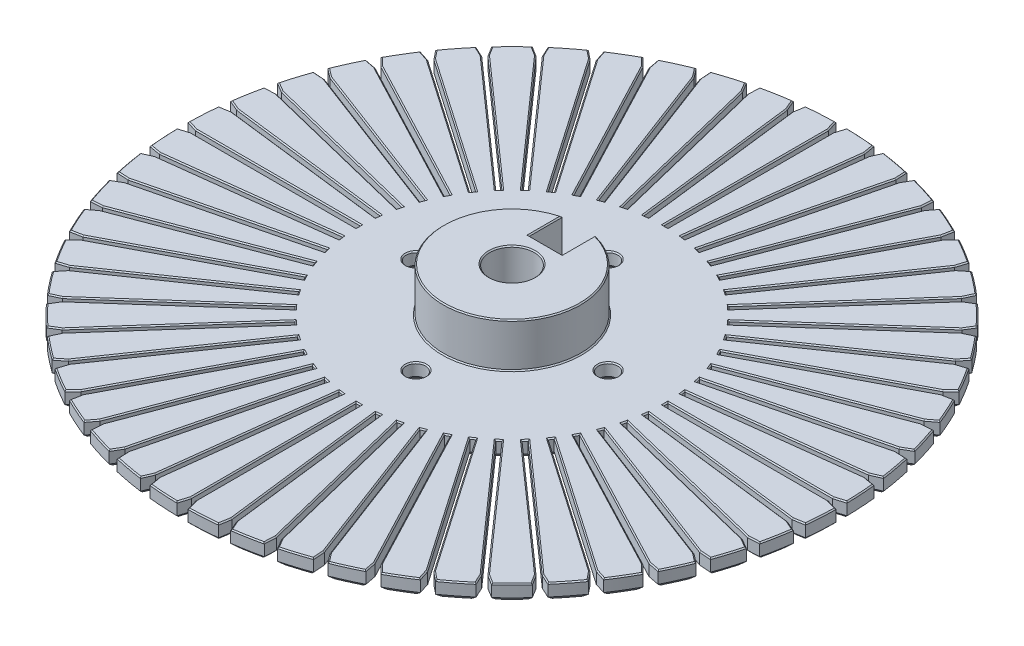
from build123d import *

# Parameters (mm, degrees)
SKIZZE1_R                       = 60
AUFSATZ_LINEAR_AUSTRAGEN1_DEPTH = 3
SCHNITT_LINEAR_START            = -5
SCHNITT_LINEAR_AUSTRAGEN1_DEPTH = 5
AUFSATZ_LINEAR_AUSTRAGEN2_DEPTH = 8
SKIZZE4_R                       = 4.05
SCHNITT_LINEAR_AUSTRAGEN4_DEPTH = 86.551154288
SKIZZE5_R                       = 1.75
SCHNITT_LINEAR_AUSTRAGEN5_DEPTH = 3
FASE1_SIZE                      = 0.8
FASE2_SIZE                      = 0.2


with BuildPart() as part:
    # Skizze1 → Aufsatz-Linear austragen1 (new body)
    with BuildSketch(Plane(origin=(0, 0, 0), x_dir=(1, 0, 0), z_dir=(0, 1, 0))):
        with Locations(Location((0, 0, 0), (0, 0, 270))):
            Circle(SKIZZE1_R)
    extrude(amount=AUFSATZ_LINEAR_AUSTRAGEN1_DEPTH)

    # Skizze2 → Schnitt-Linear austragen1 (cut)
    with BuildSketch(Plane(origin=(0, 3, 0), x_dir=(1, 0, 0), z_dir=(0, 1, 0)).offset(SCHNITT_LINEAR_START)):
        with BuildLine():
            Line((27.991666088, 0.4), (27.991666088, -0.4))
            Line((27.991666088, -0.4), (57.991666088, -0.4))
            Line((57.991666088, -0.4), (59.991666088, -1))
            ThreePointArc((59.991666088, -1), (60, 0), (59.991666088, 1))
            Line((59.991666088, 1), (57.991666088, 0.4))
            Line((57.991666088, 0.4), (27.991666088, 0.4))
        make_face()
        with BuildLine():
            Line((27.835789998, -2.976938955), (27.739360654, -3.771106055))
            Line((27.739360654, -3.771106055), (57.520626877, -7.387206462))
            Line((57.520626877, -7.387206462), (59.433722617, -8.223905147))
            ThreePointArc((59.433722617, -8.223905147), (59.562532446, -7.232200815), (59.674795978, -6.238487399))
            Line((59.674795978, -6.238487399), (57.617056221, -6.593039363))
            Line((57.617056221, -6.593039363), (27.835789998, -2.976938955))
        make_face()
        with BuildLine():
            Line((27.27400541, -6.310467437), (27.082552878, -7.087220891))
            Line((27.082552878, -7.087220891), (56.210807401, -14.26669082))
            Line((56.210807401, -14.26669082), (58.009101637, -15.327887239))
            ThreePointArc((58.009101637, -15.327887239), (58.256509046, -14.358939857), (58.487732966, -13.386003604))
            Line((58.487732966, -13.386003604), (56.402259933, -13.489937366))
            Line((56.402259933, -13.489937366), (27.27400541, -6.310467437))
        make_face()
        with BuildLine():
            Line((26.314504407, -9.551975094), (26.030820497, -10.299988088))
            Line((26.030820497, -10.299988088), (54.081307778, -20.9381347))
            Line((54.081307778, -20.9381347), (55.738577331, -22.208354219))
            ThreePointArc((55.738577331, -22.208354219), (56.100974561, -21.276293223), (56.447787105, -20.338321734))
            Line((56.447787105, -20.338321734), (54.364991687, -20.190121705))
            Line((54.364991687, -20.190121705), (26.314504407, -9.551975094))
        make_face()
        with BuildLine():
            Line((24.971278674, -12.654193445), (24.599500137, -13.362558265))
            Line((24.599500137, -13.362558265), (51.163180906, -27.304253427))
            Line((51.163180906, -27.304253427), (52.655259054, -28.764973386))
            ThreePointArc((52.655259054, -28.764973386), (53.127361539, -27.883390323), (53.584705399, -26.994061335))
            Line((53.584705399, -26.994061335), (51.534959444, -26.595888606))
            Line((51.534959444, -26.595888606), (24.971278674, -12.654193445))
        make_face()
        with BuildLine():
            Line((23.263915469, -15.57188516), (22.809463671, -16.230272253))
            Line((22.809463671, -16.230272253), (47.498979648, -33.272214655))
            Line((47.498979648, -33.272214655), (48.804108532, -34.902134468))
            ThreePointArc((48.804108532, -34.902134468), (49.379031954, -34.083884804), (49.940238025, -33.256166736))
            Line((49.940238025, -33.256166736), (47.953431445, -32.613827562))
            Line((47.953431445, -32.613827562), (23.263915469, -15.57188516))
        make_face()
        with BuildLine():
            Line((21.217311989, -18.262503726), (20.686813863, -18.861312324))
            Line((20.686813863, -18.861312324), (43.142136308, -38.754992071))
            Line((43.142136308, -38.754992071), (44.241284209, -40.530343837))
            ThreePointArc((44.241284209, -40.530343837), (44.91064489, -39.787359494), (45.567529526, -39.03332234))
            Line((45.567529526, -39.03332234), (43.672634434, -38.156183473))
            Line((43.672634434, -38.156183473), (21.217311989, -18.262503726))
        make_face()
        with BuildLine():
            Line((18.861312324, -20.686813863), (18.262503726, -21.217311989))
            Line((18.262503726, -21.217311989), (38.156183473, -43.672634434))
            Line((38.156183473, -43.672634434), (39.03332234, -45.567529526))
            ThreePointArc((39.03332234, -45.567529526), (39.787359494, -44.91064489), (40.530343837, -44.241284209))
            Line((40.530343837, -44.241284209), (38.754992071, -43.142136308))
            Line((38.754992071, -43.142136308), (18.861312324, -20.686813863))
        make_face()
        with BuildLine():
            Line((16.230272253, -22.809463671), (15.57188516, -23.263915469))
            Line((15.57188516, -23.263915469), (32.613827562, -47.953431445))
            Line((32.613827562, -47.953431445), (33.256166736, -49.940238025))
            ThreePointArc((33.256166736, -49.940238025), (34.083884804, -49.379031954), (34.902134468, -48.804108532))
            Line((34.902134468, -48.804108532), (33.272214655, -47.498979648))
            Line((33.272214655, -47.498979648), (16.230272253, -22.809463671))
        make_face()
        with BuildLine():
            Line((13.362558265, -24.599500137), (12.654193445, -24.971278674))
            Line((12.654193445, -24.971278674), (26.595888606, -51.534959444))
            Line((26.595888606, -51.534959444), (26.994061335, -53.584705399))
            ThreePointArc((26.994061335, -53.584705399), (27.883390323, -53.127361539), (28.764973386, -52.655259054))
            Line((28.764973386, -52.655259054), (27.304253427, -51.163180906))
            Line((27.304253427, -51.163180906), (13.362558265, -24.599500137))
        make_face()
        with BuildLine():
            Line((10.299988088, -26.030820497), (9.551975094, -26.314504407))
            Line((9.551975094, -26.314504407), (20.190121705, -54.364991687))
            Line((20.190121705, -54.364991687), (20.338321734, -56.447787105))
            ThreePointArc((20.338321734, -56.447787105), (21.276293223, -56.100974561), (22.208354219, -55.738577331))
            Line((22.208354219, -55.738577331), (20.9381347, -54.081307778))
            Line((20.9381347, -54.081307778), (10.299988088, -26.030820497))
        make_face()
        with BuildLine():
            Line((7.087220891, -27.082552878), (6.310467437, -27.27400541))
            Line((6.310467437, -27.27400541), (13.489937366, -56.402259933))
            Line((13.489937366, -56.402259933), (13.386003604, -58.487732966))
            ThreePointArc((13.386003604, -58.487732966), (14.358939857, -58.256509046), (15.327887239, -58.009101637))
            Line((15.327887239, -58.009101637), (14.26669082, -56.210807401))
            Line((14.26669082, -56.210807401), (7.087220891, -27.082552878))
        make_face()
        with BuildLine():
            Line((3.771106055, -27.739360654), (2.976938955, -27.835789998))
            Line((2.976938955, -27.835789998), (6.593039363, -57.617056221))
            Line((6.593039363, -57.617056221), (6.238487399, -59.674795978))
            ThreePointArc((6.238487399, -59.674795978), (7.232200815, -59.562532446), (8.223905147, -59.433722617))
            Line((8.223905147, -59.433722617), (7.387206462, -57.520626877))
            Line((7.387206462, -57.520626877), (3.771106055, -27.739360654))
        make_face()
        with BuildLine():
            Line((0.4, -27.991666088), (-0.4, -27.991666088))
            Line((-0.4, -27.991666088), (-0.4, -57.991666088))
            Line((-0.4, -57.991666088), (-1, -59.991666088))
            ThreePointArc((-1, -59.991666088), (0, -60), (1, -59.991666088))
            Line((1, -59.991666088), (0.4, -57.991666088))
            Line((0.4, -57.991666088), (0.4, -27.991666088))
        make_face()
        with BuildLine():
            Line((-2.976938955, -27.835789998), (-3.771106055, -27.739360654))
            Line((-3.771106055, -27.739360654), (-7.387206462, -57.520626877))
            Line((-7.387206462, -57.520626877), (-8.223905147, -59.433722617))
            ThreePointArc((-8.223905147, -59.433722617), (-7.232200815, -59.562532446), (-6.238487399, -59.674795978))
            Line((-6.238487399, -59.674795978), (-6.593039363, -57.617056221))
            Line((-6.593039363, -57.617056221), (-2.976938955, -27.835789998))
        make_face()
        with BuildLine():
            Line((-6.310467437, -27.27400541), (-7.087220891, -27.082552878))
            Line((-7.087220891, -27.082552878), (-14.26669082, -56.210807401))
            Line((-14.26669082, -56.210807401), (-15.327887239, -58.009101637))
            ThreePointArc((-15.327887239, -58.009101637), (-14.358939857, -58.256509046), (-13.386003604, -58.487732966))
            Line((-13.386003604, -58.487732966), (-13.489937366, -56.402259933))
            Line((-13.489937366, -56.402259933), (-6.310467437, -27.27400541))
        make_face()
        with BuildLine():
            Line((-9.551975094, -26.314504407), (-10.299988088, -26.030820497))
            Line((-10.299988088, -26.030820497), (-20.9381347, -54.081307778))
            Line((-20.9381347, -54.081307778), (-22.208354219, -55.738577331))
            ThreePointArc((-22.208354219, -55.738577331), (-21.276293223, -56.100974561), (-20.338321734, -56.447787105))
            Line((-20.338321734, -56.447787105), (-20.190121705, -54.364991687))
            Line((-20.190121705, -54.364991687), (-9.551975094, -26.314504407))
        make_face()
        with BuildLine():
            Line((-12.654193445, -24.971278674), (-13.362558265, -24.599500137))
            Line((-13.362558265, -24.599500137), (-27.304253427, -51.163180906))
            Line((-27.304253427, -51.163180906), (-28.764973386, -52.655259054))
            ThreePointArc((-28.764973386, -52.655259054), (-27.883390323, -53.127361539), (-26.994061335, -53.584705399))
            Line((-26.994061335, -53.584705399), (-26.595888606, -51.534959444))
            Line((-26.595888606, -51.534959444), (-12.654193445, -24.971278674))
        make_face()
        with BuildLine():
            Line((-15.57188516, -23.263915469), (-16.230272253, -22.809463671))
            Line((-16.230272253, -22.809463671), (-33.272214655, -47.498979648))
            Line((-33.272214655, -47.498979648), (-34.902134468, -48.804108532))
            ThreePointArc((-34.902134468, -48.804108532), (-34.083884804, -49.379031954), (-33.256166736, -49.940238025))
            Line((-33.256166736, -49.940238025), (-32.613827562, -47.953431445))
            Line((-32.613827562, -47.953431445), (-15.57188516, -23.263915469))
        make_face()
        with BuildLine():
            Line((-18.262503726, -21.217311989), (-18.861312324, -20.686813863))
            Line((-18.861312324, -20.686813863), (-38.754992071, -43.142136308))
            Line((-38.754992071, -43.142136308), (-40.530343837, -44.241284209))
            ThreePointArc((-40.530343837, -44.241284209), (-39.787359494, -44.91064489), (-39.03332234, -45.567529526))
            Line((-39.03332234, -45.567529526), (-38.156183473, -43.672634434))
            Line((-38.156183473, -43.672634434), (-18.262503726, -21.217311989))
        make_face()
        with BuildLine():
            Line((-20.686813863, -18.861312324), (-21.217311989, -18.262503726))
            Line((-21.217311989, -18.262503726), (-43.672634434, -38.156183473))
            Line((-43.672634434, -38.156183473), (-45.567529526, -39.03332234))
            ThreePointArc((-45.567529526, -39.03332234), (-44.91064489, -39.787359494), (-44.241284209, -40.530343837))
            Line((-44.241284209, -40.530343837), (-43.142136308, -38.754992071))
            Line((-43.142136308, -38.754992071), (-20.686813863, -18.861312324))
        make_face()
        with BuildLine():
            Line((-22.809463671, -16.230272253), (-23.263915469, -15.57188516))
            Line((-23.263915469, -15.57188516), (-47.953431445, -32.613827562))
            Line((-47.953431445, -32.613827562), (-49.940238025, -33.256166736))
            ThreePointArc((-49.940238025, -33.256166736), (-49.379031954, -34.083884804), (-48.804108532, -34.902134468))
            Line((-48.804108532, -34.902134468), (-47.498979648, -33.272214655))
            Line((-47.498979648, -33.272214655), (-22.809463671, -16.230272253))
        make_face()
        with BuildLine():
            Line((-24.599500137, -13.362558265), (-24.971278674, -12.654193445))
            Line((-24.971278674, -12.654193445), (-51.534959444, -26.595888606))
            Line((-51.534959444, -26.595888606), (-53.584705399, -26.994061335))
            ThreePointArc((-53.584705399, -26.994061335), (-53.127361539, -27.883390323), (-52.655259054, -28.764973386))
            Line((-52.655259054, -28.764973386), (-51.163180906, -27.304253427))
            Line((-51.163180906, -27.304253427), (-24.599500137, -13.362558265))
        make_face()
        with BuildLine():
            Line((-26.030820497, -10.299988088), (-26.314504407, -9.551975094))
            Line((-26.314504407, -9.551975094), (-54.364991687, -20.190121705))
            Line((-54.364991687, -20.190121705), (-56.447787105, -20.338321734))
            ThreePointArc((-56.447787105, -20.338321734), (-56.100974561, -21.276293223), (-55.738577331, -22.208354219))
            Line((-55.738577331, -22.208354219), (-54.081307778, -20.9381347))
            Line((-54.081307778, -20.9381347), (-26.030820497, -10.299988088))
        make_face()
        with BuildLine():
            Line((-27.082552878, -7.087220891), (-27.27400541, -6.310467437))
            Line((-27.27400541, -6.310467437), (-56.402259933, -13.489937366))
            Line((-56.402259933, -13.489937366), (-58.487732966, -13.386003604))
            ThreePointArc((-58.487732966, -13.386003604), (-58.256509046, -14.358939857), (-58.009101637, -15.327887239))
            Line((-58.009101637, -15.327887239), (-56.210807401, -14.26669082))
            Line((-56.210807401, -14.26669082), (-27.082552878, -7.087220891))
        make_face()
        with BuildLine():
            Line((-27.739360654, -3.771106055), (-27.835789998, -2.976938955))
            Line((-27.835789998, -2.976938955), (-57.617056221, -6.593039363))
            Line((-57.617056221, -6.593039363), (-59.674795978, -6.238487399))
            ThreePointArc((-59.674795978, -6.238487399), (-59.562532446, -7.232200815), (-59.433722617, -8.223905147))
            Line((-59.433722617, -8.223905147), (-57.520626877, -7.387206462))
            Line((-57.520626877, -7.387206462), (-27.739360654, -3.771106055))
        make_face()
        with BuildLine():
            Line((-27.991666088, -0.4), (-27.991666088, 0.4))
            Line((-27.991666088, 0.4), (-57.991666088, 0.4))
            Line((-57.991666088, 0.4), (-59.991666088, 1))
            ThreePointArc((-59.991666088, 1), (-60, 0), (-59.991666088, -1))
            Line((-59.991666088, -1), (-57.991666088, -0.4))
            Line((-57.991666088, -0.4), (-27.991666088, -0.4))
        make_face()
        with BuildLine():
            Line((-27.835789998, 2.976938955), (-27.739360654, 3.771106055))
            Line((-27.739360654, 3.771106055), (-57.520626877, 7.387206462))
            Line((-57.520626877, 7.387206462), (-59.433722617, 8.223905147))
            ThreePointArc((-59.433722617, 8.223905147), (-59.562532446, 7.232200815), (-59.674795978, 6.238487399))
            Line((-59.674795978, 6.238487399), (-57.617056221, 6.593039363))
            Line((-57.617056221, 6.593039363), (-27.835789998, 2.976938955))
        make_face()
        with BuildLine():
            Line((-27.27400541, 6.310467437), (-27.082552878, 7.087220891))
            Line((-27.082552878, 7.087220891), (-56.210807401, 14.26669082))
            Line((-56.210807401, 14.26669082), (-58.009101637, 15.327887239))
            ThreePointArc((-58.009101637, 15.327887239), (-58.256509046, 14.358939857), (-58.487732966, 13.386003604))
            Line((-58.487732966, 13.386003604), (-56.402259933, 13.489937366))
            Line((-56.402259933, 13.489937366), (-27.27400541, 6.310467437))
        make_face()
        with BuildLine():
            Line((-26.314504407, 9.551975094), (-26.030820497, 10.299988088))
            Line((-26.030820497, 10.299988088), (-54.081307778, 20.9381347))
            Line((-54.081307778, 20.9381347), (-55.738577331, 22.208354219))
            ThreePointArc((-55.738577331, 22.208354219), (-56.100974561, 21.276293223), (-56.447787105, 20.338321734))
            Line((-56.447787105, 20.338321734), (-54.364991687, 20.190121705))
            Line((-54.364991687, 20.190121705), (-26.314504407, 9.551975094))
        make_face()
        with BuildLine():
            Line((-24.971278674, 12.654193445), (-24.599500137, 13.362558265))
            Line((-24.599500137, 13.362558265), (-51.163180906, 27.304253427))
            Line((-51.163180906, 27.304253427), (-52.655259054, 28.764973386))
            ThreePointArc((-52.655259054, 28.764973386), (-53.127361539, 27.883390323), (-53.584705399, 26.994061335))
            Line((-53.584705399, 26.994061335), (-51.534959444, 26.595888606))
            Line((-51.534959444, 26.595888606), (-24.971278674, 12.654193445))
        make_face()
        with BuildLine():
            Line((-23.263915469, 15.57188516), (-22.809463671, 16.230272253))
            Line((-22.809463671, 16.230272253), (-47.498979648, 33.272214655))
            Line((-47.498979648, 33.272214655), (-48.804108532, 34.902134468))
            ThreePointArc((-48.804108532, 34.902134468), (-49.379031954, 34.083884804), (-49.940238025, 33.256166736))
            Line((-49.940238025, 33.256166736), (-47.953431445, 32.613827562))
            Line((-47.953431445, 32.613827562), (-23.263915469, 15.57188516))
        make_face()
        with BuildLine():
            Line((-21.217311989, 18.262503726), (-20.686813863, 18.861312324))
            Line((-20.686813863, 18.861312324), (-43.142136308, 38.754992071))
            Line((-43.142136308, 38.754992071), (-44.241284209, 40.530343837))
            ThreePointArc((-44.241284209, 40.530343837), (-44.91064489, 39.787359494), (-45.567529526, 39.03332234))
            Line((-45.567529526, 39.03332234), (-43.672634434, 38.156183473))
            Line((-43.672634434, 38.156183473), (-21.217311989, 18.262503726))
        make_face()
        with BuildLine():
            Line((-18.861312324, 20.686813863), (-18.262503726, 21.217311989))
            Line((-18.262503726, 21.217311989), (-38.156183473, 43.672634434))
            Line((-38.156183473, 43.672634434), (-39.03332234, 45.567529526))
            ThreePointArc((-39.03332234, 45.567529526), (-39.787359494, 44.91064489), (-40.530343837, 44.241284209))
            Line((-40.530343837, 44.241284209), (-38.754992071, 43.142136308))
            Line((-38.754992071, 43.142136308), (-18.861312324, 20.686813863))
        make_face()
        with BuildLine():
            Line((-16.230272253, 22.809463671), (-15.57188516, 23.263915469))
            Line((-15.57188516, 23.263915469), (-32.613827562, 47.953431445))
            Line((-32.613827562, 47.953431445), (-33.256166736, 49.940238025))
            ThreePointArc((-33.256166736, 49.940238025), (-34.083884804, 49.379031954), (-34.902134468, 48.804108532))
            Line((-34.902134468, 48.804108532), (-33.272214655, 47.498979648))
            Line((-33.272214655, 47.498979648), (-16.230272253, 22.809463671))
        make_face()
        with BuildLine():
            Line((-13.362558265, 24.599500137), (-12.654193445, 24.971278674))
            Line((-12.654193445, 24.971278674), (-26.595888606, 51.534959444))
            Line((-26.595888606, 51.534959444), (-26.994061335, 53.584705399))
            ThreePointArc((-26.994061335, 53.584705399), (-27.883390323, 53.127361539), (-28.764973386, 52.655259054))
            Line((-28.764973386, 52.655259054), (-27.304253427, 51.163180906))
            Line((-27.304253427, 51.163180906), (-13.362558265, 24.599500137))
        make_face()
        with BuildLine():
            Line((-10.299988088, 26.030820497), (-9.551975094, 26.314504407))
            Line((-9.551975094, 26.314504407), (-20.190121705, 54.364991687))
            Line((-20.190121705, 54.364991687), (-20.338321734, 56.447787105))
            ThreePointArc((-20.338321734, 56.447787105), (-21.276293223, 56.100974561), (-22.208354219, 55.738577331))
            Line((-22.208354219, 55.738577331), (-20.9381347, 54.081307778))
            Line((-20.9381347, 54.081307778), (-10.299988088, 26.030820497))
        make_face()
        with BuildLine():
            Line((-7.087220891, 27.082552878), (-6.310467437, 27.27400541))
            Line((-6.310467437, 27.27400541), (-13.489937366, 56.402259933))
            Line((-13.489937366, 56.402259933), (-13.386003604, 58.487732966))
            ThreePointArc((-13.386003604, 58.487732966), (-14.358939857, 58.256509046), (-15.327887239, 58.009101637))
            Line((-15.327887239, 58.009101637), (-14.26669082, 56.210807401))
            Line((-14.26669082, 56.210807401), (-7.087220891, 27.082552878))
        make_face()
        with BuildLine():
            Line((-3.771106055, 27.739360654), (-2.976938955, 27.835789998))
            Line((-2.976938955, 27.835789998), (-6.593039363, 57.617056221))
            Line((-6.593039363, 57.617056221), (-6.238487399, 59.674795978))
            ThreePointArc((-6.238487399, 59.674795978), (-7.232200815, 59.562532446), (-8.223905147, 59.433722617))
            Line((-8.223905147, 59.433722617), (-7.387206462, 57.520626877))
            Line((-7.387206462, 57.520626877), (-3.771106055, 27.739360654))
        make_face()
        with BuildLine():
            Line((-0.4, 27.991666088), (0.4, 27.991666088))
            Line((0.4, 27.991666088), (0.4, 57.991666088))
            Line((0.4, 57.991666088), (1, 59.991666088))
            ThreePointArc((1, 59.991666088), (0, 60), (-1, 59.991666088))
            Line((-1, 59.991666088), (-0.4, 57.991666088))
            Line((-0.4, 57.991666088), (-0.4, 27.991666088))
        make_face()
        with BuildLine():
            Line((2.976938955, 27.835789998), (3.771106055, 27.739360654))
            Line((3.771106055, 27.739360654), (7.387206462, 57.520626877))
            Line((7.387206462, 57.520626877), (8.223905147, 59.433722617))
            ThreePointArc((8.223905147, 59.433722617), (7.232200815, 59.562532446), (6.238487399, 59.674795978))
            Line((6.238487399, 59.674795978), (6.593039363, 57.617056221))
            Line((6.593039363, 57.617056221), (2.976938955, 27.835789998))
        make_face()
        with BuildLine():
            Line((6.310467437, 27.27400541), (7.087220891, 27.082552878))
            Line((7.087220891, 27.082552878), (14.26669082, 56.210807401))
            Line((14.26669082, 56.210807401), (15.327887239, 58.009101637))
            ThreePointArc((15.327887239, 58.009101637), (14.358939857, 58.256509046), (13.386003604, 58.487732966))
            Line((13.386003604, 58.487732966), (13.489937366, 56.402259933))
            Line((13.489937366, 56.402259933), (6.310467437, 27.27400541))
        make_face()
        with BuildLine():
            Line((9.551975094, 26.314504407), (10.299988088, 26.030820497))
            Line((10.299988088, 26.030820497), (20.9381347, 54.081307778))
            Line((20.9381347, 54.081307778), (22.208354219, 55.738577331))
            ThreePointArc((22.208354219, 55.738577331), (21.276293223, 56.100974561), (20.338321734, 56.447787105))
            Line((20.338321734, 56.447787105), (20.190121705, 54.364991687))
            Line((20.190121705, 54.364991687), (9.551975094, 26.314504407))
        make_face()
        with BuildLine():
            Line((12.654193445, 24.971278674), (13.362558265, 24.599500137))
            Line((13.362558265, 24.599500137), (27.304253427, 51.163180906))
            Line((27.304253427, 51.163180906), (28.764973386, 52.655259054))
            ThreePointArc((28.764973386, 52.655259054), (27.883390323, 53.127361539), (26.994061335, 53.584705399))
            Line((26.994061335, 53.584705399), (26.595888606, 51.534959444))
            Line((26.595888606, 51.534959444), (12.654193445, 24.971278674))
        make_face()
        with BuildLine():
            Line((15.57188516, 23.263915469), (16.230272253, 22.809463671))
            Line((16.230272253, 22.809463671), (33.272214655, 47.498979648))
            Line((33.272214655, 47.498979648), (34.902134468, 48.804108532))
            ThreePointArc((34.902134468, 48.804108532), (34.083884804, 49.379031954), (33.256166736, 49.940238025))
            Line((33.256166736, 49.940238025), (32.613827562, 47.953431445))
            Line((32.613827562, 47.953431445), (15.57188516, 23.263915469))
        make_face()
        with BuildLine():
            Line((18.262503726, 21.217311989), (18.861312324, 20.686813863))
            Line((18.861312324, 20.686813863), (38.754992071, 43.142136308))
            Line((38.754992071, 43.142136308), (40.530343837, 44.241284209))
            ThreePointArc((40.530343837, 44.241284209), (39.787359494, 44.91064489), (39.03332234, 45.567529526))
            Line((39.03332234, 45.567529526), (38.156183473, 43.672634434))
            Line((38.156183473, 43.672634434), (18.262503726, 21.217311989))
        make_face()
        with BuildLine():
            Line((20.686813863, 18.861312324), (21.217311989, 18.262503726))
            Line((21.217311989, 18.262503726), (43.672634434, 38.156183473))
            Line((43.672634434, 38.156183473), (45.567529526, 39.03332234))
            ThreePointArc((45.567529526, 39.03332234), (44.91064489, 39.787359494), (44.241284209, 40.530343837))
            Line((44.241284209, 40.530343837), (43.142136308, 38.754992071))
            Line((43.142136308, 38.754992071), (20.686813863, 18.861312324))
        make_face()
        with BuildLine():
            Line((22.809463671, 16.230272253), (23.263915469, 15.57188516))
            Line((23.263915469, 15.57188516), (47.953431445, 32.613827562))
            Line((47.953431445, 32.613827562), (49.940238025, 33.256166736))
            ThreePointArc((49.940238025, 33.256166736), (49.379031954, 34.083884804), (48.804108532, 34.902134468))
            Line((48.804108532, 34.902134468), (47.498979648, 33.272214655))
            Line((47.498979648, 33.272214655), (22.809463671, 16.230272253))
        make_face()
        with BuildLine():
            Line((24.599500137, 13.362558265), (24.971278674, 12.654193445))
            Line((24.971278674, 12.654193445), (51.534959444, 26.595888606))
            Line((51.534959444, 26.595888606), (53.584705399, 26.994061335))
            ThreePointArc((53.584705399, 26.994061335), (53.127361539, 27.883390323), (52.655259054, 28.764973386))
            Line((52.655259054, 28.764973386), (51.163180906, 27.304253427))
            Line((51.163180906, 27.304253427), (24.599500137, 13.362558265))
        make_face()
        with BuildLine():
            Line((26.030820497, 10.299988088), (26.314504407, 9.551975094))
            Line((26.314504407, 9.551975094), (54.364991687, 20.190121705))
            Line((54.364991687, 20.190121705), (56.447787105, 20.338321734))
            ThreePointArc((56.447787105, 20.338321734), (56.100974561, 21.276293223), (55.738577331, 22.208354219))
            Line((55.738577331, 22.208354219), (54.081307778, 20.9381347))
            Line((54.081307778, 20.9381347), (26.030820497, 10.299988088))
        make_face()
        with BuildLine():
            Line((27.082552878, 7.087220891), (27.27400541, 6.310467437))
            Line((27.27400541, 6.310467437), (56.402259933, 13.489937366))
            Line((56.402259933, 13.489937366), (58.487732966, 13.386003604))
            ThreePointArc((58.487732966, 13.386003604), (58.256509046, 14.358939857), (58.009101637, 15.327887239))
            Line((58.009101637, 15.327887239), (56.210807401, 14.26669082))
            Line((56.210807401, 14.26669082), (27.082552878, 7.087220891))
        make_face()
        with BuildLine():
            Line((27.739360654, 3.771106055), (27.835789998, 2.976938955))
            Line((27.835789998, 2.976938955), (57.617056221, 6.593039363))
            Line((57.617056221, 6.593039363), (59.674795978, 6.238487399))
            ThreePointArc((59.674795978, 6.238487399), (59.562532446, 7.232200815), (59.433722617, 8.223905147))
            Line((59.433722617, 8.223905147), (57.520626877, 7.387206462))
            Line((57.520626877, 7.387206462), (27.739360654, 3.771106055))
        make_face()
    extrude(amount=SCHNITT_LINEAR_AUSTRAGEN1_DEPTH, mode=Mode.SUBTRACT)

    # Skizze3 → Aufsatz-Linear austragen2 (add)
    with BuildSketch(Plane(origin=(0, 3, 0), x_dir=(1, 0, 0), z_dir=(0, 1, 0))):
        with BuildLine():
            Line((-3, 12.1346611), (-3, 6.1346611))
            Line((-3, 6.1346611), (3, 6.1346611))
            Line((3, 6.1346611), (3, 12.1346611))
            ThreePointArc((3, 12.1346611), (0, -12.5), (-3, 12.1346611))
        make_face()
    extrude(amount=AUFSATZ_LINEAR_AUSTRAGEN2_DEPTH)

    # Skizze4 → Schnitt-Linear austragen4 (cut, through all)
    with BuildSketch(Plane(origin=(0, 11, 0), x_dir=(1, 0, 0), z_dir=(0, 1, 0))):
        with Locations(Location((0, 0, 0), (0, 0, 270))):
            Circle(SKIZZE4_R)
    extrude(amount=-SCHNITT_LINEAR_AUSTRAGEN4_DEPTH, mode=Mode.SUBTRACT)

    # Skizze5 → Schnitt-Linear austragen5 (cut)
    with BuildSketch(Plane(origin=(0, 3, 0), x_dir=(1, 0, 0), z_dir=(0, 1, 0))):
        with Locations(Location((0, 17.5, 0), (0, 0, 270))):
            Circle(SKIZZE5_R)
        with Locations(Location((17.5, 0, 0), (0, 0, 270))):
            Circle(SKIZZE5_R)
        with Locations(Location((-17.5, 0, 0), (0, 0, 270))):
            Circle(SKIZZE5_R)
        with Locations(Location((0, -17.5, 0), (0, 0, 270))):
            Circle(SKIZZE5_R)
    extrude(amount=-SCHNITT_LINEAR_AUSTRAGEN5_DEPTH, mode=Mode.SUBTRACT)

    # Fase1
    fase1_edges = [part.edges().sort_by_distance(p)[0] for p in [
        (54.71399076, 0, 24.624768327),
        (17.850183231, 0, -57.283251991),
        (20.26422172, 0, -55.406389396),
        (14.8710484, 0, -40.339748047),
        (9.925981591, 0, -26.172662452),
        (52.559832421, 0, 26.794974971),
        (15.619061394, 0, -40.056064137),
        (21.573244459, 0, -54.909942554),
        (38.253119059, 0, 19.625041026),
        (24.785389406, 0, 13.008375855),
        (37.881340522, 0, 20.333405846),
        (51.90921998, 0, 28.034613406),
        (24.624768327, 0, -54.71399076),
        (26.794974971, 0, -52.559832421),
        (19.625041026, 0, -38.253119059),
        (13.008375855, 0, -24.785389406),
        (20.333405846, 0, -37.881340522),
        (28.034613406, 0, -51.90921998),
        (31.040268851, 0, -51.346876338),
        (32.934997149, 0, -48.946834735),
        (24.092856361, 0, -35.608673457),
        (15.901078707, 0, -23.03668957),
        (24.751243454, 0, -35.15422166),
        (34.087174562, 0, -48.15154409),
        (37.003132358, 0, -47.231008837),
        (38.594752907, 0, -44.62008198),
        (28.209343599, 0, -32.444973212),
        (18.561908025, 0, -20.952062926),
        (28.808152198, 0, -31.914475085),
        (39.642667954, 0, -43.691710259),
        (42.426406871, 0, -42.426406871),
        (43.691710259, 0, -39.642667954),
        (31.914475085, 0, -28.808152198),
        (20.952062926, 0, -18.561908025),
        (32.444973212, 0, -28.209343599),
        (44.62008198, 0, -38.594752907),
        (47.231008837, 0, -37.003132358),
        (48.15154409, 0, -34.087174562),
        (35.15422166, 0, -24.751243454),
        (23.03668957, 0, -15.901078707),
        (35.608673457, 0, -24.092856361),
        (48.946834735, 0, -32.934997149),
        (51.346876338, 0, -31.040268851),
        (51.90921998, 0, -28.034613406),
        (37.881340522, 0, -20.333405846),
        (24.785389406, 0, -13.008375855),
        (38.253119059, 0, -19.625041026),
        (52.559832421, 0, -26.794974971),
        (54.71399076, 0, -24.624768327),
        (54.909942554, 0, -21.573244459),
        (40.056064137, 0, -15.619061394),
        (26.172662452, 0, -9.925981591),
        (40.339748047, 0, -14.8710484),
        (55.406389396, 0, -20.26422172),
        (57.283251991, 0, -17.850183231),
        (57.109954519, 0, -14.797289029),
        (41.64668014, 0, -10.676955856),
        (27.178279144, 0, -6.698844164),
        (41.838132671, 0, -9.900202402),
        (57.444996449, 0, -13.437970485),
        (59.017194417, 0, -10.815302269),
        (58.477174747, 0, -7.805555805),
        (42.629993766, 0, -5.579156259),
        (27.787575326, 0, -3.374022505),
        (42.72642311, 0, -4.784989159),
        (58.645926099, 0, -6.415763381),
        (51.346876338, 0, 31.040268851),
        (48.946834735, 0, 32.934997149),
        (35.608673457, 0, 24.092856361),
        (23.03668957, 0, 15.901078707),
        (35.15422166, 0, 24.751243454),
        (48.15154409, 0, 34.087174562),
        (0, 0, -4.05),
        (0, 0, -19.25),
        (17.5, 0, -1.75),
        (-17.5, 0, -1.75),
        (0, 0, 15.75),
        (47.231008837, 0, 37.003132358),
        (44.62008198, 0, 38.594752907),
        (32.444973212, 0, 28.209343599),
        (20.952062926, 0, 18.561908025),
        (31.914475085, 0, 28.808152198),
        (43.691710259, 0, 39.642667954),
        (42.426406871, 0, 42.426406871),
        (39.642667954, 0, 43.691710259),
        (28.808152198, 0, 31.914475085),
        (18.561908025, 0, 20.952062926),
        (28.209343599, 0, 32.444973212),
        (38.594752907, 0, 44.62008198),
        (37.003132358, 0, 47.231008837),
        (34.087174562, 0, 48.15154409),
        (24.751243454, 0, 35.15422166),
        (15.901078707, 0, 23.03668957),
        (24.092856361, 0, 35.608673457),
        (32.934997149, 0, 48.946834735),
        (31.040268851, 0, 51.346876338),
        (28.034613406, 0, 51.90921998),
        (20.333405846, 0, 37.881340522),
        (13.008375855, 0, 24.785389406),
        (19.625041026, 0, 38.253119059),
        (26.794974971, 0, 52.559832421),
        (24.624768327, 0, 54.71399076),
        (21.573244459, 0, 54.909942554),
        (15.619061394, 0, 40.056064137),
        (9.925981591, 0, 26.172662452),
        (14.8710484, 0, 40.339748047),
        (20.26422172, 0, 55.406389396),
        (17.850183231, 0, 57.283251991),
        (14.797289029, 0, 57.109954519),
        (10.676955856, 0, 41.64668014),
        (6.698844164, 0, 27.178279144),
        (9.900202402, 0, 41.838132671),
        (13.437970485, 0, 57.444996449),
        (59.890533253, 0, 3.622709845),
        (10.815302269, 0, 59.017194417),
        (7.805555805, 0, 58.477174747),
        (5.579156259, 0, 42.629993766),
        (3.374022505, 0, 27.787575326),
        (58.645926099, 0, 6.415763381),
        (4.784989159, 0, 42.72642311),
        (6.415763381, 0, 58.645926099),
        (42.72642311, 0, 4.784989159),
        (27.787575326, 0, 3.374022505),
        (42.629993766, 0, 5.579156259),
        (58.477174747, 0, 7.805555805),
        (3.622709845, 0, 59.890533253),
        (0.7, 0, 58.991666088),
        (0.4, 0, 42.991666088),
        (0, 0, 27.991666088),
        (-0.4, 0, 42.991666088),
        (-0.7, 0, 58.991666088),
        (-3.622709845, 0, 59.890533253),
        (-6.415763381, 0, 58.645926099),
        (-4.784989159, 0, 42.72642311),
        (-3.374022505, 0, 27.787575326),
        (-5.579156259, 0, 42.629993766),
        (-7.805555805, 0, 58.477174747),
        (-10.815302269, 0, 59.017194417),
        (-13.437970485, 0, 57.444996449),
        (-9.900202402, 0, 41.838132671),
        (-6.698844164, 0, 27.178279144),
        (-10.676955856, 0, 41.64668014),
        (-14.797289029, 0, 57.109954519),
        (-17.850183231, 0, 57.283251991),
        (-20.26422172, 0, 55.406389396),
        (-14.8710484, 0, 40.339748047),
        (-9.925981591, 0, 26.172662452),
        (-15.619061394, 0, 40.056064137),
        (-21.573244459, 0, 54.909942554),
        (-24.624768327, 0, 54.71399076),
        (-26.794974971, 0, 52.559832421),
        (-19.625041026, 0, 38.253119059),
        (-13.008375855, 0, 24.785389406),
        (-20.333405846, 0, 37.881340522),
        (-28.034613406, 0, 51.90921998),
        (-31.040268851, 0, 51.346876338),
        (-32.934997149, 0, 48.946834735),
        (-24.092856361, 0, 35.608673457),
        (-15.901078707, 0, 23.03668957),
        (-24.751243454, 0, 35.15422166),
        (-34.087174562, 0, 48.15154409),
        (-37.003132358, 0, 47.231008837),
        (-38.594752907, 0, 44.62008198),
        (-28.209343599, 0, 32.444973212),
        (-18.561908025, 0, 20.952062926),
        (-28.808152198, 0, 31.914475085),
        (-39.642667954, 0, 43.691710259),
        (-42.426406871, 0, 42.426406871),
        (-43.691710259, 0, 39.642667954),
        (-31.914475085, 0, 28.808152198),
        (-20.952062926, 0, 18.561908025),
        (-32.444973212, 0, 28.209343599),
        (-44.62008198, 0, 38.594752907),
        (-47.231008837, 0, 37.003132358),
        (-48.15154409, 0, 34.087174562),
        (-35.15422166, 0, 24.751243454),
        (-23.03668957, 0, 15.901078707),
        (-35.608673457, 0, 24.092856361),
        (-48.946834735, 0, 32.934997149),
        (59.017194417, 0, 10.815302269),
        (-51.346876338, 0, 31.040268851),
        (-51.90921998, 0, 28.034613406),
        (-37.881340522, 0, 20.333405846),
        (-24.785389406, 0, 13.008375855),
        (57.444996449, 0, 13.437970485),
        (-38.253119059, 0, 19.625041026),
        (-52.559832421, 0, 26.794974971),
        (41.838132671, 0, 9.900202402),
        (27.178279144, 0, 6.698844164),
        (41.64668014, 0, 10.676955856),
        (57.109954519, 0, 14.797289029),
        (59.890533253, 0, -3.622709845),
        (-54.71399076, 0, 24.624768327),
        (-54.909942554, 0, 21.573244459),
        (-40.056064137, 0, 15.619061394),
        (-26.172662452, 0, 9.925981591),
        (-40.339748047, 0, 14.8710484),
        (-55.406389396, 0, 20.26422172),
        (-57.283251991, 0, 17.850183231),
        (-57.109954519, 0, 14.797289029),
        (-41.64668014, 0, 10.676955856),
        (-27.178279144, 0, 6.698844164),
        (-41.838132671, 0, 9.900202402),
        (-57.444996449, 0, 13.437970485),
        (58.991666088, 0, -0.7),
        (-59.017194417, 0, 10.815302269),
        (-58.477174747, 0, 7.805555805),
        (-42.629993766, 0, 5.579156259),
        (-27.787575326, 0, 3.374022505),
        (-42.72642311, 0, 4.784989159),
        (-58.645926099, 0, 6.415763381),
        (42.991666088, 0, -0.4),
        (-59.890533253, 0, 3.622709845),
        (-58.991666088, 0, 0.7),
        (-42.991666088, 0, 0.4),
        (-27.991666088, 0, 0),
        (-42.991666088, 0, -0.4),
        (-58.991666088, 0, -0.7),
        (-59.890533253, 0, -3.622709845),
        (-58.645926099, 0, -6.415763381),
        (-42.72642311, 0, -4.784989159),
        (-27.787575326, 0, -3.374022505),
        (-42.629993766, 0, -5.579156259),
        (-58.477174747, 0, -7.805555805),
        (27.991666088, 0, 0),
        (-59.017194417, 0, -10.815302269),
        (-57.444996449, 0, -13.437970485),
        (-41.838132671, 0, -9.900202402),
        (-27.178279144, 0, -6.698844164),
        (-41.64668014, 0, -10.676955856),
        (-57.109954519, 0, -14.797289029),
        (-57.283251991, 0, -17.850183231),
        (-55.406389396, 0, -20.26422172),
        (-40.339748047, 0, -14.8710484),
        (-26.172662452, 0, -9.925981591),
        (-40.056064137, 0, -15.619061394),
        (-54.909942554, 0, -21.573244459),
        (42.991666088, 0, 0.4),
        (-54.71399076, 0, -24.624768327),
        (-52.559832421, 0, -26.794974971),
        (-38.253119059, 0, -19.625041026),
        (-24.785389406, 0, -13.008375855),
        (-37.881340522, 0, -20.333405846),
        (-51.90921998, 0, -28.034613406),
        (58.991666088, 0, 0.7),
        (-51.346876338, 0, -31.040268851),
        (-48.946834735, 0, -32.934997149),
        (-35.608673457, 0, -24.092856361),
        (-23.03668957, 0, -15.901078707),
        (-35.15422166, 0, -24.751243454),
        (-48.15154409, 0, -34.087174562),
        (57.283251991, 0, 17.850183231),
        (-47.231008837, 0, -37.003132358),
        (-44.62008198, 0, -38.594752907),
        (-32.444973212, 0, -28.209343599),
        (-20.952062926, 0, -18.561908025),
        (55.406389396, 0, 20.26422172),
        (-31.914475085, 0, -28.808152198),
        (-43.691710259, 0, -39.642667954),
        (40.339748047, 0, 14.8710484),
        (26.172662452, 0, 9.925981591),
        (40.056064137, 0, 15.619061394),
        (54.909942554, 0, 21.573244459),
        (-42.426406871, 0, -42.426406871),
        (-39.642667954, 0, -43.691710259),
        (-28.808152198, 0, -31.914475085),
        (-18.561908025, 0, -20.952062926),
        (-28.209343599, 0, -32.444973212),
        (-38.594752907, 0, -44.62008198),
        (-37.003132358, 0, -47.231008837),
        (-34.087174562, 0, -48.15154409),
        (-24.751243454, 0, -35.15422166),
        (-15.901078707, 0, -23.03668957),
        (-24.092856361, 0, -35.608673457),
        (-32.934997149, 0, -48.946834735),
        (-31.040268851, 0, -51.346876338),
        (-28.034613406, 0, -51.90921998),
        (-20.333405846, 0, -37.881340522),
        (-13.008375855, 0, -24.785389406),
        (-19.625041026, 0, -38.253119059),
        (-26.794974971, 0, -52.559832421),
        (-24.624768327, 0, -54.71399076),
        (-21.573244459, 0, -54.909942554),
        (-15.619061394, 0, -40.056064137),
        (-9.925981591, 0, -26.172662452),
        (-14.8710484, 0, -40.339748047),
        (-20.26422172, 0, -55.406389396),
        (-17.850183231, 0, -57.283251991),
        (-14.797289029, 0, -57.109954519),
        (-10.676955856, 0, -41.64668014),
        (-6.698844164, 0, -27.178279144),
        (-9.900202402, 0, -41.838132671),
        (-13.437970485, 0, -57.444996449),
        (-10.815302269, 0, -59.017194417),
        (-7.805555805, 0, -58.477174747),
        (-5.579156259, 0, -42.629993766),
        (-3.374022505, 0, -27.787575326),
        (-4.784989159, 0, -42.72642311),
        (-6.415763381, 0, -58.645926099),
        (-3.622709845, 0, -59.890533253),
        (-0.7, 0, -58.991666088),
        (-0.4, 0, -42.991666088),
        (0, 0, -27.991666088),
        (0.4, 0, -42.991666088),
        (0.7, 0, -58.991666088),
        (3.622709845, 0, -59.890533253),
        (6.415763381, 0, -58.645926099),
        (4.784989159, 0, -42.72642311),
        (3.374022505, 0, -27.787575326),
        (5.579156259, 0, -42.629993766),
        (7.805555805, 0, -58.477174747),
        (10.815302269, 0, -59.017194417),
        (13.437970485, 0, -57.444996449),
        (9.900202402, 0, -41.838132671),
        (6.698844164, 0, -27.178279144),
        (10.676955856, 0, -41.64668014),
        (14.797289029, 0, -57.109954519),
    ]]
    chamfer(fase1_edges, length=FASE1_SIZE)

    # Fase2
    fase2_edges = [part.edges().sort_by_distance(p)[0] for p in [
        (10.815302269, 3, -59.017194417),
        (13.437970485, 3, -57.444996449),
        (9.900202402, 3, -41.838132671),
        (6.698844164, 3, -27.178279144),
        (10.676955856, 3, -41.64668014),
        (14.797289029, 3, -57.109954519),
        (17.850183231, 3, -57.283251991),
        (20.26422172, 3, -55.406389396),
        (14.8710484, 3, -40.339748047),
        (9.925981591, 3, -26.172662452),
        (15.619061394, 3, -40.056064137),
        (21.573244459, 3, -54.909942554),
        (54.71399076, 3, 24.624768327),
        (24.624768327, 3, -54.71399076),
        (26.794974971, 3, -52.559832421),
        (19.625041026, 3, -38.253119059),
        (13.008375855, 3, -24.785389406),
        (20.333405846, 3, -37.881340522),
        (28.034613406, 3, -51.90921998),
        (31.040268851, 3, -51.346876338),
        (32.934997149, 3, -48.946834735),
        (24.092856361, 3, -35.608673457),
        (15.901078707, 3, -23.03668957),
        (24.751243454, 3, -35.15422166),
        (34.087174562, 3, -48.15154409),
        (37.003132358, 3, -47.231008837),
        (38.594752907, 3, -44.62008198),
        (28.209343599, 3, -32.444973212),
        (18.561908025, 3, -20.952062926),
        (28.808152198, 3, -31.914475085),
        (39.642667954, 3, -43.691710259),
        (52.559832421, 3, 26.794974971),
        (42.426406871, 3, -42.426406871),
        (38.253119059, 3, 19.625041026),
        (24.785389406, 3, 13.008375855),
        (43.691710259, 3, -39.642667954),
        (31.914475085, 3, -28.808152198),
        (37.881340522, 3, 20.333405846),
        (20.952062926, 3, -18.561908025),
        (32.444973212, 3, -28.209343599),
        (44.62008198, 3, -38.594752907),
        (51.90921998, 3, 28.034613406),
        (47.231008837, 3, -37.003132358),
        (48.15154409, 3, -34.087174562),
        (35.15422166, 3, -24.751243454),
        (23.03668957, 3, -15.901078707),
        (35.608673457, 3, -24.092856361),
        (48.946834735, 3, -32.934997149),
        (51.346876338, 3, -31.040268851),
        (51.90921998, 3, -28.034613406),
        (37.881340522, 3, -20.333405846),
        (24.785389406, 3, -13.008375855),
        (38.253119059, 3, -19.625041026),
        (52.559832421, 3, -26.794974971),
        (54.71399076, 3, -24.624768327),
        (54.909942554, 3, -21.573244459),
        (40.056064137, 3, -15.619061394),
        (26.172662452, 3, -9.925981591),
        (40.339748047, 3, -14.8710484),
        (55.406389396, 3, -20.26422172),
        (57.283251991, 3, -17.850183231),
        (57.109954519, 3, -14.797289029),
        (41.64668014, 3, -10.676955856),
        (27.178279144, 3, -6.698844164),
        (41.838132671, 3, -9.900202402),
        (57.444996449, 3, -13.437970485),
        (59.017194417, 3, -10.815302269),
        (58.477174747, 3, -7.805555805),
        (42.629993766, 3, -5.579156259),
        (27.787575326, 3, -3.374022505),
        (42.72642311, 3, -4.784989159),
        (58.645926099, 3, -6.415763381),
        (51.346876338, 3, 31.040268851),
        (0, 3, 12.5),
        (3, 3, -9.1346611),
        (0, 3, -6.1346611),
        (-3, 3, -9.1346611),
        (0, 11, 12.5),
        (3, 11, -9.1346611),
        (0, 11, -6.1346611),
        (-3, 11, -9.1346611),
        (0, 11, -4.05),
        (48.946834735, 3, 32.934997149),
        (35.608673457, 3, 24.092856361),
        (0, 3, -19.25),
        (23.03668957, 3, 15.901078707),
        (17.5, 3, -1.75),
        (35.15422166, 3, 24.751243454),
        (-17.5, 3, -1.75),
        (48.15154409, 3, 34.087174562),
        (0, 3, 15.75),
        (58.991666088, 3, -0.7),
        (47.231008837, 3, 37.003132358),
        (42.991666088, 3, -0.4),
        (27.991666088, 3, 0),
        (44.62008198, 3, 38.594752907),
        (32.444973212, 3, 28.209343599),
        (42.991666088, 3, 0.4),
        (20.952062926, 3, 18.561908025),
        (31.914475085, 3, 28.808152198),
        (43.691710259, 3, 39.642667954),
        (58.991666088, 3, 0.7),
        (42.426406871, 3, 42.426406871),
        (39.642667954, 3, 43.691710259),
        (28.808152198, 3, 31.914475085),
        (18.561908025, 3, 20.952062926),
        (28.209343599, 3, 32.444973212),
        (38.594752907, 3, 44.62008198),
        (37.003132358, 3, 47.231008837),
        (34.087174562, 3, 48.15154409),
        (24.751243454, 3, 35.15422166),
        (15.901078707, 3, 23.03668957),
        (24.092856361, 3, 35.608673457),
        (32.934997149, 3, 48.946834735),
        (31.040268851, 3, 51.346876338),
        (28.034613406, 3, 51.90921998),
        (20.333405846, 3, 37.881340522),
        (13.008375855, 3, 24.785389406),
        (19.625041026, 3, 38.253119059),
        (26.794974971, 3, 52.559832421),
        (24.624768327, 3, 54.71399076),
        (21.573244459, 3, 54.909942554),
        (15.619061394, 3, 40.056064137),
        (9.925981591, 3, 26.172662452),
        (14.8710484, 3, 40.339748047),
        (20.26422172, 3, 55.406389396),
        (17.850183231, 3, 57.283251991),
        (14.797289029, 3, 57.109954519),
        (10.676955856, 3, 41.64668014),
        (6.698844164, 3, 27.178279144),
        (9.900202402, 3, 41.838132671),
        (13.437970485, 3, 57.444996449),
        (10.815302269, 3, 59.017194417),
        (7.805555805, 3, 58.477174747),
        (5.579156259, 3, 42.629993766),
        (3.374022505, 3, 27.787575326),
        (4.784989159, 3, 42.72642311),
        (6.415763381, 3, 58.645926099),
        (59.890533253, 3, 3.622709845),
        (3.622709845, 3, 59.890533253),
        (0.7, 3, 58.991666088),
        (0.4, 3, 42.991666088),
        (0, 3, 27.991666088),
        (-0.4, 3, 42.991666088),
        (-0.7, 3, 58.991666088),
        (-3.622709845, 3, 59.890533253),
        (-6.415763381, 3, 58.645926099),
        (-4.784989159, 3, 42.72642311),
        (-3.374022505, 3, 27.787575326),
        (-5.579156259, 3, 42.629993766),
        (-7.805555805, 3, 58.477174747),
        (-10.815302269, 3, 59.017194417),
        (-13.437970485, 3, 57.444996449),
        (-9.900202402, 3, 41.838132671),
        (-6.698844164, 3, 27.178279144),
        (-10.676955856, 3, 41.64668014),
        (-14.797289029, 3, 57.109954519),
        (58.645926099, 3, 6.415763381),
        (-17.850183231, 3, 57.283251991),
        (42.72642311, 3, 4.784989159),
        (27.787575326, 3, 3.374022505),
        (-20.26422172, 3, 55.406389396),
        (-14.8710484, 3, 40.339748047),
        (42.629993766, 3, 5.579156259),
        (-9.925981591, 3, 26.172662452),
        (-15.619061394, 3, 40.056064137),
        (-21.573244459, 3, 54.909942554),
        (58.477174747, 3, 7.805555805),
        (-24.624768327, 3, 54.71399076),
        (-26.794974971, 3, 52.559832421),
        (-19.625041026, 3, 38.253119059),
        (-13.008375855, 3, 24.785389406),
        (-20.333405846, 3, 37.881340522),
        (-28.034613406, 3, 51.90921998),
        (-31.040268851, 3, 51.346876338),
        (-32.934997149, 3, 48.946834735),
        (-24.092856361, 3, 35.608673457),
        (-15.901078707, 3, 23.03668957),
        (-24.751243454, 3, 35.15422166),
        (-34.087174562, 3, 48.15154409),
        (-37.003132358, 3, 47.231008837),
        (-38.594752907, 3, 44.62008198),
        (-28.209343599, 3, 32.444973212),
        (-18.561908025, 3, 20.952062926),
        (-28.808152198, 3, 31.914475085),
        (-39.642667954, 3, 43.691710259),
        (-42.426406871, 3, 42.426406871),
        (-43.691710259, 3, 39.642667954),
        (-31.914475085, 3, 28.808152198),
        (-20.952062926, 3, 18.561908025),
        (-32.444973212, 3, 28.209343599),
        (-44.62008198, 3, 38.594752907),
        (-47.231008837, 3, 37.003132358),
        (-48.15154409, 3, 34.087174562),
        (-35.15422166, 3, 24.751243454),
        (-23.03668957, 3, 15.901078707),
        (-35.608673457, 3, 24.092856361),
        (-48.946834735, 3, 32.934997149),
        (-51.346876338, 3, 31.040268851),
        (-51.90921998, 3, 28.034613406),
        (-37.881340522, 3, 20.333405846),
        (-24.785389406, 3, 13.008375855),
        (-38.253119059, 3, 19.625041026),
        (-52.559832421, 3, 26.794974971),
        (59.017194417, 3, 10.815302269),
        (-54.71399076, 3, 24.624768327),
        (-54.909942554, 3, 21.573244459),
        (-40.056064137, 3, 15.619061394),
        (-26.172662452, 3, 9.925981591),
        (-40.339748047, 3, 14.8710484),
        (-55.406389396, 3, 20.26422172),
        (-57.283251991, 3, 17.850183231),
        (-57.109954519, 3, 14.797289029),
        (-41.64668014, 3, 10.676955856),
        (-27.178279144, 3, 6.698844164),
        (-41.838132671, 3, 9.900202402),
        (-57.444996449, 3, 13.437970485),
        (-59.017194417, 3, 10.815302269),
        (-58.477174747, 3, 7.805555805),
        (-42.629993766, 3, 5.579156259),
        (-27.787575326, 3, 3.374022505),
        (-42.72642311, 3, 4.784989159),
        (-58.645926099, 3, 6.415763381),
        (57.444996449, 3, 13.437970485),
        (-59.890533253, 3, 3.622709845),
        (41.838132671, 3, 9.900202402),
        (27.178279144, 3, 6.698844164),
        (-58.991666088, 3, 0.7),
        (-42.991666088, 3, 0.4),
        (41.64668014, 3, 10.676955856),
        (-27.991666088, 3, 0),
        (-42.991666088, 3, -0.4),
        (-58.991666088, 3, -0.7),
        (57.109954519, 3, 14.797289029),
        (-59.890533253, 3, -3.622709845),
        (-58.645926099, 3, -6.415763381),
        (-42.72642311, 3, -4.784989159),
        (-27.787575326, 3, -3.374022505),
        (-42.629993766, 3, -5.579156259),
        (-58.477174747, 3, -7.805555805),
        (-59.017194417, 3, -10.815302269),
        (-57.444996449, 3, -13.437970485),
        (-41.838132671, 3, -9.900202402),
        (-27.178279144, 3, -6.698844164),
        (-41.64668014, 3, -10.676955856),
        (-57.109954519, 3, -14.797289029),
        (-57.283251991, 3, -17.850183231),
        (-55.406389396, 3, -20.26422172),
        (-40.339748047, 3, -14.8710484),
        (-26.172662452, 3, -9.925981591),
        (-40.056064137, 3, -15.619061394),
        (-54.909942554, 3, -21.573244459),
        (-54.71399076, 3, -24.624768327),
        (-52.559832421, 3, -26.794974971),
        (-38.253119059, 3, -19.625041026),
        (-24.785389406, 3, -13.008375855),
        (-37.881340522, 3, -20.333405846),
        (-51.90921998, 3, -28.034613406),
        (-51.346876338, 3, -31.040268851),
        (-48.946834735, 3, -32.934997149),
        (-35.608673457, 3, -24.092856361),
        (-23.03668957, 3, -15.901078707),
        (-35.15422166, 3, -24.751243454),
        (-48.15154409, 3, -34.087174562),
        (-47.231008837, 3, -37.003132358),
        (-44.62008198, 3, -38.594752907),
        (-32.444973212, 3, -28.209343599),
        (-20.952062926, 3, -18.561908025),
        (-31.914475085, 3, -28.808152198),
        (-43.691710259, 3, -39.642667954),
        (57.283251991, 3, 17.850183231),
        (-42.426406871, 3, -42.426406871),
        (-39.642667954, 3, -43.691710259),
        (-28.808152198, 3, -31.914475085),
        (-18.561908025, 3, -20.952062926),
        (-28.209343599, 3, -32.444973212),
        (-38.594752907, 3, -44.62008198),
        (59.890533253, 3, -3.622709845),
        (-37.003132358, 3, -47.231008837),
        (-34.087174562, 3, -48.15154409),
        (-24.751243454, 3, -35.15422166),
        (-15.901078707, 3, -23.03668957),
        (-24.092856361, 3, -35.608673457),
        (-32.934997149, 3, -48.946834735),
        (-31.040268851, 3, -51.346876338),
        (-28.034613406, 3, -51.90921998),
        (-20.333405846, 3, -37.881340522),
        (-13.008375855, 3, -24.785389406),
        (-19.625041026, 3, -38.253119059),
        (-26.794974971, 3, -52.559832421),
        (55.406389396, 3, 20.26422172),
        (-24.624768327, 3, -54.71399076),
        (40.339748047, 3, 14.8710484),
        (26.172662452, 3, 9.925981591),
        (-21.573244459, 3, -54.909942554),
        (-15.619061394, 3, -40.056064137),
        (40.056064137, 3, 15.619061394),
        (-9.925981591, 3, -26.172662452),
        (-14.8710484, 3, -40.339748047),
        (-20.26422172, 3, -55.406389396),
        (54.909942554, 3, 21.573244459),
        (-17.850183231, 3, -57.283251991),
        (-14.797289029, 3, -57.109954519),
        (-10.676955856, 3, -41.64668014),
        (-6.698844164, 3, -27.178279144),
        (-9.900202402, 3, -41.838132671),
        (-13.437970485, 3, -57.444996449),
        (-10.815302269, 3, -59.017194417),
        (-7.805555805, 3, -58.477174747),
        (-5.579156259, 3, -42.629993766),
        (-3.374022505, 3, -27.787575326),
        (-4.784989159, 3, -42.72642311),
        (-6.415763381, 3, -58.645926099),
        (-3.622709845, 3, -59.890533253),
        (-0.7, 3, -58.991666088),
        (-0.4, 3, -42.991666088),
        (0, 3, -27.991666088),
        (0.4, 3, -42.991666088),
        (0.7, 3, -58.991666088),
        (3.622709845, 3, -59.890533253),
        (6.415763381, 3, -58.645926099),
        (4.784989159, 3, -42.72642311),
        (3.374022505, 3, -27.787575326),
        (5.579156259, 3, -42.629993766),
        (7.805555805, 3, -58.477174747),
    ]]
    chamfer(fase2_edges, length=FASE2_SIZE)


solid = part.part
